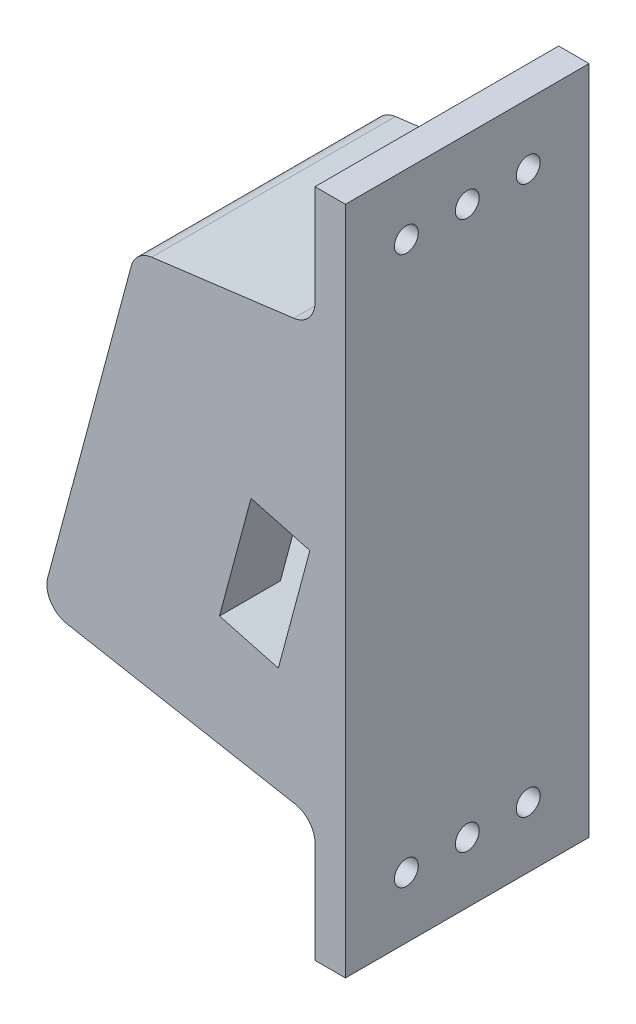
from build123d import *

# Parameters (mm, degrees)
BOSS_EXTRUDE1_DEPTH     = 50.8
SKETCH3_W               = 44.45
SKETCH3_H               = 50.8
CUT_EXTRUDE1_DEPTH      = 25.4
SKETCH4_R               = 2.4892
CUT_EXTRUDE2_DEPTH      = 17.78
SKETCH7_W               = 25.4
SKETCH7_H               = 25.4
CUT_EXTRUDE3_DEPTH      = 19.05
CUT_EXTRUDE4_DEPTH      = 159.113724894
CUT_EXTRUDE4_DEPTH_BACK = 159.113724894
SKETCH10_R              = 2.4892
CUT_EXTRUDE5_DEPTH      = 160.257189791
FILLET1_R               = 5.08


with BuildPart() as part:
    # Sketch1 → Boss-Extrude1 (new body)
    with BuildSketch(Plane.XY):
        Polygon((0, 0), (0, -139.7), (-6.35, -139.7), (-6.35, -114.3), (-63.5, -103.787780153), (-43.777988763, -30.184232189), (-6.35, -25.4), (-6.35, 0), align=None)
    extrude(amount=BOSS_EXTRUDE1_DEPTH)

    # Sketch3 → Cut-Extrude1 (cut)
    with BuildSketch(Plane(origin=(-33.299361532, 8.922537031, 0), x_dir=(0, 0, 1), z_dir=(-0.9659258262890682, 0.2588190451025214, 0))):
        with Locations((25.4, -78.586306667)):
            Rectangle(SKETCH3_W, SKETCH3_H)
    extrude(amount=-CUT_EXTRUDE1_DEPTH, mode=Mode.SUBTRACT)

    # Sketch4 → Cut-Extrude2 (cut)
    with BuildSketch(Plane(origin=(-33.299361532, 8.922537031, 0), x_dir=(0, 0, 1), z_dir=(-0.9659258262890682, 0.2588190451025214, 0))):
        with Locations(Location((25.4, -46.836306667, 0), (0, 0, 270))):
            Circle(SKETCH4_R)
        with Locations(Location((25.4, -110.336306667, 0), (0, 0, 270))):
            Circle(SKETCH4_R)
    extrude(amount=-CUT_EXTRUDE2_DEPTH, mode=Mode.SUBTRACT)

    # Sketch7 → Cut-Extrude3 (cut)
    with BuildSketch(Plane(origin=(-8.764845544, 2.348533285, 0), x_dir=(0, 0, 1), z_dir=(-0.9659258262890681, 0.25881904510252124, 0))):
        with Locations((25.4, -78.586306667)):
            Rectangle(SKETCH7_W, SKETCH7_H)
    extrude(amount=-CUT_EXTRUDE3_DEPTH, mode=Mode.SUBTRACT)

    # Sketch9 → Cut-Extrude4 (cut, two sides: drawn at the far end of the back side and taken through both)
    with BuildSketch(Plane(origin=(0, 0, 38.1), x_dir=(-1, 0, 0), z_dir=(0, 0, -1)).offset(-CUT_EXTRUDE4_DEPTH_BACK)):
        Polygon((7.41658953, -66.223254732), (13.990593276, -90.75777072), (26.25785127, -87.470768847), (19.683847524, -62.936252859), align=None)
    extrude(amount=CUT_EXTRUDE4_DEPTH + CUT_EXTRUDE4_DEPTH_BACK, mode=Mode.SUBTRACT)

    # Sketch10 → Cut-Extrude5 (cut, through all)
    with BuildSketch(Plane.ZY.offset(6.35)):
        with Locations(Location((25.4, -12.7, 0), (0, 0, 270))):
            Circle(SKETCH10_R)
        with Locations(Location((12.7, -12.7, 0), (0, 0, 270))):
            Circle(SKETCH10_R)
        with Locations(Location((12.7, -127, 0), (0, 0, 270))):
            Circle(SKETCH10_R)
        with Locations(Location((38.1, -127, 0), (0, 0, 270))):
            Circle(SKETCH10_R)
        with Locations(Location((38.1, -12.7, 0), (0, 0, 270))):
            Circle(SKETCH10_R)
        with Locations(Location((25.4, -127, 0), (0, 0, 270))):
            Circle(SKETCH10_R)
    extrude(amount=-CUT_EXTRUDE5_DEPTH, mode=Mode.SUBTRACT)

    # Fillet1
    # the kernel refuses this fillet: 5.08 mm, written as the material it adds along each edge
    with BuildSketch(Plane(origin=(-6.35, -25.4, 0), x_dir=(0, 1, 0), z_dir=(0, 0, 1))) as fillet1_piece_1:
        with BuildLine():
            CenterArc((FILLET1_R * 0.880311524947, FILLET1_R), FILLET1_R, 187.284330246, 82.715669754)
            Line((-FILLET1_R * 0.111617631295, FILLET1_R * 0.873206668172), (0, 0))
            Line((0, 0), (FILLET1_R * 0.880311524947, 0))
        make_face()
    extrude(amount=50.8)
    with BuildSketch(Plane(origin=(-6.35, -114.3, 0), x_dir=(0, -1, 0), z_dir=(0, 0, 1))) as fillet1_piece_2:
        with BuildLine():
            CenterArc((FILLET1_R * 0.832835540577, -FILLET1_R), FILLET1_R, 90, 79.57746931)
            Line((-FILLET1_R * 0.150664867797, -FILLET1_R * 0.819094094265), (0, 0))
            Line((0, 0), (FILLET1_R * 0.832835540577, 0))
        make_face()
    extrude(amount=50.8)
    # the kernel refuses this fillet: 5.08 mm, written as the material it takes off along each edge
    with BuildSketch(Plane(origin=(-43.777988763, -30.184232189, -8.520486112), x_dir=(0.9919291562424372, 0.12679333182847863, 0), z_dir=(0, 0, 1))) as fillet1_2_piece_1:
        with BuildLine():
            CenterArc((FILLET1_R * 0.670904418298, -FILLET1_R), FILLET1_R, 90, 67.715669754)
            Line((-FILLET1_R * 0.254409042496, -FILLET1_R * 0.620796889158), (0, 0))
            Line((0, 0), (FILLET1_R * 0.670904418298, 0))
        make_face()
    extrude(amount=67.840972225, mode=Mode.SUBTRACT)
    with BuildSketch(Plane(origin=(-63.5, -103.787780153, -13.757429812), x_dir=(0.983500408373109, -0.18090590573535092, 0), z_dir=(0, 0, 1))) as fillet1_2_piece_2:
        with BuildLine():
            CenterArc((FILLET1_R * 1.0832621899, FILLET1_R), FILLET1_R, 175.42253069, 94.57746931)
            Line((FILLET1_R * 0.0864518515073, FILLET1_R * 1.07980695008), (0, 0))
            Line((0, 0), (FILLET1_R * 1.0832621899, 0))
        make_face()
    extrude(amount=78.314859623, mode=Mode.SUBTRACT)


solid = part.part
